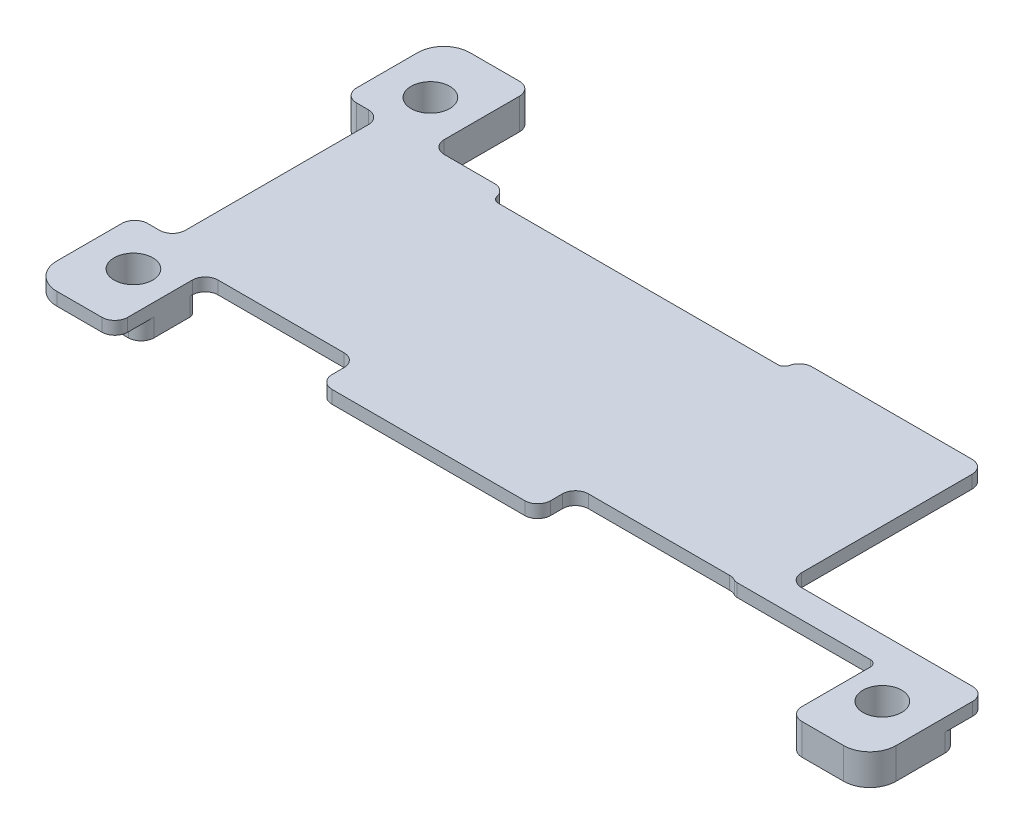
from build123d import *

# Parameters (mm, degrees)
BOSS_EXTRUDE1_START = 1.4
SKETCH2_R           = 1.5
BOSS_EXTRUDE1_DEPTH = 1
SKETCH4_W           = 51.3
SKETCH4_H           = 7.828136
CUT_EXTRUDE1_DEPTH  = 37.239562
SKETCH5_W           = 15.253092
SKETCH5_H           = 23.040436
CUT_EXTRUDE2_DEPTH  = 37.239562
SKETCH6_W           = 22.069426
SKETCH6_H           = 6.8
SKETCH6_W_2         = 11.75
SKETCH6_H_2         = 7
CUT_EXTRUDE3_DEPTH  = 37.239562
SKETCH7_W           = 2.92226
SKETCH7_H           = 16.173552
SKETCH7_W_2         = 22.599024
SKETCH7_H_2         = 1.175102
CUT_EXTRUDE4_DEPTH  = 37.239562
FILLET8_R           = 1
FILLET10_R          = 0.5
SKETCH9_W           = 12.4
SKETCH9_H           = 15
SKETCH9_W_2         = 15
BOSS_EXTRUDE2_DEPTH = 0.35
FILLET3_R           = 0.5
BOSS_EXTRUDE3_START = -2.4
SKETCH10_R          = 1.5
BOSS_EXTRUDE3_DEPTH = 2.4
FILLET6_R           = 0.5
FILLET11_R          = 1
FILLET13_R          = 0.5


with BuildPart() as part:
    # Sketch2 → Boss-Extrude1 (new body)
    with BuildSketch(Plane(origin=(0, 0, 0), x_dir=(1, 0, 0), z_dir=(0, 1, 0)).offset(BOSS_EXTRUDE1_START)):
        with BuildLine():
            Line((-32.500062, 13.969619), (-32.500062, -13.969619))
            ThreePointArc((-32.500062, -13.969619), (-31.904903, -15.40646), (-30.468062, -16.001619))
            Line((-30.468062, -16.001619), (30.468062, -16.001619))
            ThreePointArc((30.468062, -16.001619), (31.904903, -15.40646), (32.500062, -13.969619))
            Line((32.500062, -13.969619), (32.500062, 13.969619))
            ThreePointArc((32.500062, 13.969619), (31.904903, 15.40646), (30.468062, 16.001619))
            Line((30.468062, 16.001619), (-30.468062, 16.001619))
            ThreePointArc((-30.468062, 16.001619), (-31.904903, 15.40646), (-32.500062, 13.969619))
        make_face()
        with Locations(Location((28.999942, 11.463655, 0), (0, 0, 270))):
            Circle(SKETCH2_R, mode=Mode.SUBTRACT)
        with Locations(Location((28.999942, -11.536299, 0), (0, 0, 270))):
            Circle(SKETCH2_R, mode=Mode.SUBTRACT)
        with Locations(Location((-29.000196, -11.536299, 0), (0, 0, 270))):
            Circle(SKETCH2_R, mode=Mode.SUBTRACT)
        with Locations(Location((-29.000196, 11.463655, 0), (0, 0, 270))):
            Circle(SKETCH2_R, mode=Mode.SUBTRACT)
    extrude(amount=BOSS_EXTRUDE1_DEPTH)

    # Sketch4 → Cut-Extrude1 (cut, through all)
    with BuildSketch(Plane(origin=(0, 2.4, 0), x_dir=(1, 0, 0), z_dir=(0, 1, 0))):
        with Locations((0.010922, 12.087551)):
            Rectangle(SKETCH4_W, SKETCH4_H)
    extrude(amount=-CUT_EXTRUDE1_DEPTH, mode=Mode.SUBTRACT)

    # Sketch5 → Cut-Extrude2 (cut, through all)
    with BuildSketch(Plane(origin=(0, 2.4, 0), x_dir=(1, 0, 0), z_dir=(0, 1, 0))):
        with Locations((24.873516, 4.481401)):
            Rectangle(SKETCH5_W, SKETCH5_H)
    extrude(amount=-CUT_EXTRUDE2_DEPTH, mode=Mode.SUBTRACT)

    # Sketch6 → Cut-Extrude3 (cut, through all)
    with BuildSketch(Plane(origin=(0, 2.4, 0), x_dir=(1, 0, 0), z_dir=(0, 1, 0))):
        with Locations((15.204059, -12.601619)):
            Rectangle(SKETCH6_W, SKETCH6_H)
        with Locations((-20.100036, -12.501619)):
            Rectangle(SKETCH6_W_2, SKETCH6_H_2)
    extrude(amount=-CUT_EXTRUDE3_DEPTH, mode=Mode.SUBTRACT)

    # Sketch7 → Cut-Extrude4 (cut, through all)
    with BuildSketch(Plane(origin=(0, 2.4, 0), x_dir=(1, 0, 0), z_dir=(0, 1, 0))):
        Polygon((2.69737, -11.925317), (2.69737, -9.001619), (15.24697, -9.001619), (15.24697, -16.001619), (-14.225036, -16.001619), (-14.225036, -11.925317), align=None)
        with Locations((-31.038932, 0.152527)):
            Rectangle(SKETCH7_W, SKETCH7_H)
        with Locations((-8.452542, 7.585932)):
            Rectangle(SKETCH7_W_2, SKETCH7_H_2)
    extrude(amount=-CUT_EXTRUDE4_DEPTH, mode=Mode.SUBTRACT)

    # Fillet8
    # the kernel refuses this fillet: 1 mm, written as the material it adds along each edge
    with BuildSketch(Plane(origin=(15.24697, 2.4, 9.001619), x_dir=(0, 0, 1), z_dir=(0, -1, 0))) as fillet8_piece_1:
        with BuildLine():
            CenterArc((1, 0.6), FILLET8_R, 180, 36.869898)
            Line((0, 0.6), (0, 0))
            Line((0, 0), (0.2, 0))
        make_face()
    extrude(amount=1)
    with BuildSketch(Plane(origin=(-29.577802, 2.4, 7.934249), x_dir=(-1, 0, 0), z_dir=(0, -1, 0)), Plane(origin=(-25.975036, 2.4, 9.001619), x_dir=(1, 0, 0), z_dir=(0, -1, 0)), Plane(origin=(-14.225036, 2.4, 9.001619), x_dir=(0, 0, 1), z_dir=(0, -1, 0)), Plane(origin=(2.69737, 2.4, 9.001619), x_dir=(1, 0, 0), z_dir=(0, -1, 0)), Plane(origin=(17.24697, 2.4, 7.038817), x_dir=(0, 0, -1), z_dir=(0, -1, 0)), Plane(origin=(-25.639078, 2.4, -8.173483), x_dir=(0, 0, -1), z_dir=(0, -1, 0)), Plane(origin=(-29.577802, 2.4, -8.239303), x_dir=(0, 0, 1), z_dir=(0, -1, 0))) as fillet8_piece_2:
        with BuildLine():
            CenterArc((FILLET8_R, FILLET8_R), FILLET8_R, 180, 90)
            Line((0, FILLET8_R), (0, 0))
            Line((0, 0), (FILLET8_R, 0))
        make_face()
    extrude(amount=1)
    # the kernel refuses this fillet: 1 mm, written as the material it takes off along each edge
    with BuildSketch(Plane(origin=(-32.500062, 4.9, 7.934249), x_dir=(0, 0, 1), z_dir=(0, -1, 0)), Plane(origin=(-25.975036, 4.9, 16.001619), x_dir=(0, 0, -1), z_dir=(0, -1, 0)), Plane(origin=(-14.225036, 4.9, 11.925317), x_dir=(1, 0, 0), z_dir=(0, -1, 0)), Plane(origin=(2.69737, 4.9, 11.925317), x_dir=(0, 0, -1), z_dir=(0, -1, 0)), Plane(origin=(26.238772, 4.9, 16.001619), x_dir=(1, 0, 0), z_dir=(0, -1, 0)), Plane(origin=(2.84697, 4.9, -8.173483), x_dir=(0, 0, 1), z_dir=(0, -1, 0)), Plane(origin=(-19.752054, 4.9, -8.173483), x_dir=(-1, 0, 0), z_dir=(0, -1, 0)), Plane(origin=(-25.639078, 4.9, -16.001619), x_dir=(-1, 0, 0), z_dir=(0, -1, 0)), Plane(origin=(-32.500062, 4.9, -8.239303), x_dir=(1, 0, 0), z_dir=(0, -1, 0)), Plane(origin=(32.500062, 4.9, 7.038817), x_dir=(-1, 0, 0), z_dir=(0, -1, 0))) as fillet8_2_piece_1:
        with BuildLine():
            CenterArc((FILLET8_R, -FILLET8_R), FILLET8_R, 90, 90)
            Line((0, -FILLET8_R), (0, 0))
            Line((0, 0), (FILLET8_R, 0))
        make_face()
    extrude(amount=6, mode=Mode.SUBTRACT)
    with BuildSketch(Plane(origin=(17.24697, -1.1, -8.173483), x_dir=(-1, 0, 0), z_dir=(0, 1, 0))) as fillet8_2_piece_2:
        with BuildLine():
            CenterArc((FILLET8_R, FILLET8_R), FILLET8_R, 180, 90)
            Line((0, FILLET8_R), (0, 0))
            Line((0, 0), (FILLET8_R, 0))
        make_face()
    extrude(amount=6, mode=Mode.SUBTRACT)

    # Fillet10
    fillet10_edges = [part.edges().sort_by_distance(p)[0] for p in [
        (26.238772, 1.9, 9.201619),
    ]]
    fillet(fillet10_edges, radius=FILLET10_R)

    # Sketch9 → Boss-Extrude2 (add)
    with BuildSketch(Plane.XZ.offset(-1.4)):
        with Locations((10.04697, 0.326517)):
            Rectangle(SKETCH9_W, SKETCH9_H)
        with Locations((-5.80263, 3.425317)):
            Rectangle(SKETCH9_W_2, SKETCH9_H)
    extrude(amount=BOSS_EXTRUDE2_DEPTH)

    # Fillet3
    fillet3_edges = [part.edges().sort_by_distance(p)[0] for p in [
        (16.24697, 1.225, 7.826517),
        (3.84697, 1.225, 7.826517),
        (3.84697, 1.225, -7.173483),
        (16.24697, 1.225, -7.173483),
        (1.69737, 1.225, 10.925317),
        (-13.30263, 1.225, 10.925317),
        (-13.30263, 1.225, -4.074683),
        (1.69737, 1.225, -4.074683),
    ]]
    fillet(fillet3_edges, radius=FILLET3_R)

    # Sketch10 → Boss-Extrude3 (add)
    # profile 1 of 3: a face of its own
    with BuildSketch(Plane(origin=(0, 2.4, 0), x_dir=(1, 0, 0), z_dir=(0, 1, 0)).offset(BOSS_EXTRUDE3_START)):
        with BuildLine():
            Line((-30.577802, 8.239303), (-25.639078, 8.239303))
            Line((-25.639078, 8.239303), (-25.639078, 9.173483))
            Line((-25.639078, 9.173483), (-25.639078, 15.001619))
            ThreePointArc((-25.639078, 15.001619), (-25.931971, 15.708726), (-26.639078, 16.001619))
            Line((-26.639078, 16.001619), (-30.468062, 16.001619))
            ThreePointArc((-30.468062, 16.001619), (-31.904903, 15.40646), (-32.500062, 13.969619))
            Line((-32.500062, 13.969619), (-32.500062, 9.239303))
            ThreePointArc((-32.500062, 9.239303), (-32.207169, 8.532196), (-31.500062, 8.239303))
            Line((-31.500062, 8.239303), (-30.577802, 8.239303))
        make_face()
        with Locations(Location((-29.000196, 11.463655, 0), (0, 0, 270))):
            Circle(SKETCH10_R, mode=Mode.SUBTRACT)
    # profile 2 of 3: a face of its own
    with BuildSketch(Plane(origin=(0, 2.4, 0), x_dir=(1, 0, 0), z_dir=(0, 1, 0)).offset(BOSS_EXTRUDE3_START)):
        with BuildLine():
            Line((-25.975036, -10.001619), (-25.975036, -13.958671))
            Line((-25.975036, -13.958671), (-32.500062, -13.958671))
            Line((-32.500062, -13.958671), (-32.500062, -8.934249))
            ThreePointArc((-32.500062, -8.934249), (-32.207169, -8.227142), (-31.500062, -7.934249))
            Line((-31.500062, -7.934249), (-30.577802, -7.934249))
            ThreePointArc((-30.577802, -7.934249), (-28.054933, -8.47482), (-25.975036, -10.001619))
        make_face()
        with Locations(Location((-29.000196, -11.536299, 0), (0, 0, 270))):
            Circle(SKETCH10_R, mode=Mode.SUBTRACT)
    # profile 3 of 3: a face of its own
    with BuildSketch(Plane(origin=(0, 2.4, 0), x_dir=(1, 0, 0), z_dir=(0, 1, 0)).offset(BOSS_EXTRUDE3_START)):
        with BuildLine():
            Line((26.238772, -9.701619), (26.238772, -9.185593))
            Line((26.238772, -9.185593), (32.500062, -9.185593))
            Line((32.500062, -9.185593), (32.500062, -13.969619))
            ThreePointArc((32.500062, -13.969619), (31.904903, -15.40646), (30.468062, -16.001619))
            Line((30.468062, -16.001619), (27.238772, -16.001619))
            ThreePointArc((27.238772, -16.001619), (26.531665, -15.708726), (26.238772, -15.001619))
            Line((26.238772, -15.001619), (26.238772, -9.701619))
        make_face()
        with Locations(Location((28.999942, -11.536299, 0), (0, 0, 270))):
            Circle(SKETCH10_R, mode=Mode.SUBTRACT)
    extrude(amount=BOSS_EXTRUDE3_DEPTH)

    # Fillet6
    fillet6_edges = [part.edges().sort_by_distance(p)[0] for p in [
        (15.24697, 1.9, 9.201619),
        (2.84697, 1.9, -6.998381),
        (-19.752054, 1.9, -6.998381),
        (-25.639078, 0.7, -8.239303),
    ]]
    fillet(fillet6_edges, radius=FILLET6_R)

    # Fillet11
    fillet11_edges = [part.edges().sort_by_distance(p)[0] for p in [
        (-25.975036, 0.7, 13.958671),
        (-32.500062, 0.7, 13.958671),
        (32.500062, 0.7, 9.185593),
    ]]
    fillet(fillet11_edges, radius=FILLET11_R)

    # Fillet13
    fillet13_edges = [part.edges().sort_by_distance(p)[0] for p in [
        (-25.975036, 0.7, 10.001619),
        (26.238772, 0.7, 9.185593),
    ]]
    fillet(fillet13_edges, radius=FILLET13_R)


solid = part.part
